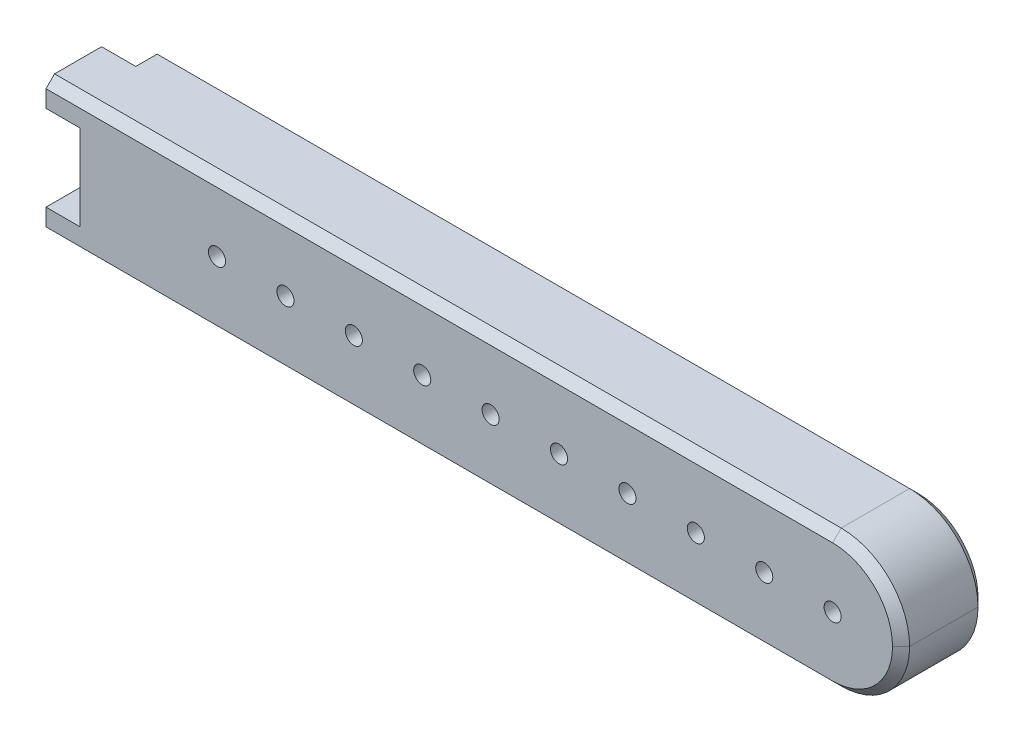
from build123d import *

# Parameters (mm, degrees)
BOSS_EXTRUDE1_DEPTH         = 10
M4_TAPPED_HOLE1_D           = 3.3
M4_TAPPED_HOLE1_DEPTH       = 10.1
M4_TAPPED_HOLE1_CSINK_D     = 4.05
M4_TAPPED_HOLE1_CSINK_ANGLE = 90
M4_TAPPED_HOLE1_TIP         = 0.991420021
FILLET1_R                   = 8
CHAMFER1_SIZE               = 1
SKETCH4_R                   = 1
CUT_EXTRUDE1_DEPTH          = 10
SKETCH6_W                   = 3.5
SKETCH6_H                   = 16
CUT_EXTRUDE3_DEPTH          = 4
FILLET3_R                   = 2


with BuildPart() as part:
    # Sketch1 → Boss-Extrude1 (new body)
    with BuildSketch(Plane.XY):
        Polygon((-50, 8), (50, 8), (50, -8), (-50, -8), (-50, -5), (-46, -5), (-46, 5), (-50, 5), align=None)
    extrude(amount=BOSS_EXTRUDE1_DEPTH)

    # M4 Tapped Hole1
    with Locations(Plane(origin=(-46, 0, 5), x_dir=(0, 0, -1), z_dir=(-1, 0, 0))):
        with Locations((0, 0)):
            CounterSinkHole(M4_TAPPED_HOLE1_D / 2, M4_TAPPED_HOLE1_CSINK_D / 2, depth=M4_TAPPED_HOLE1_DEPTH, counter_sink_angle=M4_TAPPED_HOLE1_CSINK_ANGLE)
            with Locations((0, 0, -(M4_TAPPED_HOLE1_DEPTH + M4_TAPPED_HOLE1_TIP / 2))):  # 118° drill point
                Cone(0, M4_TAPPED_HOLE1_D / 2, M4_TAPPED_HOLE1_TIP, mode=Mode.SUBTRACT)

    # Fillet1
    fillet1_edges = [part.edges().sort_by_distance(p)[0] for p in [
        (50, 8, 5),
        (50, -8, 5),
    ]]
    fillet(fillet1_edges, radius=FILLET1_R - 0.0001)  # a hair under: the kernel refuses the full size

    # Chamfer1
    chamfer1_edges = [part.edges().sort_by_distance(p)[0] for p in [
        (-3.99995, -8, 10),
        (-3.99995, 8, 0),
        (-3.99995, 8, 10),
        (47.656883539, -5.656883539, 0),
        (47.656883539, 5.656883539, 0),
        (47.656883539, -5.656883539, 10),
        (47.656883539, 5.656883539, 10),
        (-3.99995, -8, 0),
    ]]
    chamfer(chamfer1_edges, length=CHAMFER1_SIZE)

    # Sketch4 → Cut-Extrude1 (cut)
    with BuildSketch(Plane(origin=(0, 0, 0), x_dir=(-1, 0, 0), z_dir=(0, 0, -1))):
        with Locations((-42, 0)):
            Circle(SKETCH4_R)
        with Locations((-34, 0)):
            Circle(SKETCH4_R)
        with Locations((-26, 0)):
            Circle(SKETCH4_R)
        with Locations((-18, 0)):
            Circle(SKETCH4_R)
        with Locations((-10, 0)):
            Circle(SKETCH4_R)
        with Locations((-2, 0)):
            Circle(SKETCH4_R)
        with Locations((6, 0)):
            Circle(SKETCH4_R)
        with Locations((14, 0)):
            Circle(SKETCH4_R)
        with Locations((22, 0)):
            Circle(SKETCH4_R)
        with Locations((30, 0)):
            Circle(SKETCH4_R)
    extrude(amount=-CUT_EXTRUDE1_DEPTH, mode=Mode.SUBTRACT)

    # Sketch6 → Cut-Extrude3 (cut)
    with BuildSketch(Plane.ZY.offset(50)):
        with Locations((1.75, 0)):
            Rectangle(SKETCH6_W, SKETCH6_H)
    extrude(amount=-CUT_EXTRUDE3_DEPTH, mode=Mode.SUBTRACT)

    # Fillet3
    fillet3_edges = [part.edges().sort_by_distance(p)[0] for p in [
        (-48, 5, 3.5),
        (-48, -5, 3.5),
    ]]
    fillet(fillet3_edges, radius=FILLET3_R)


solid = part.part
